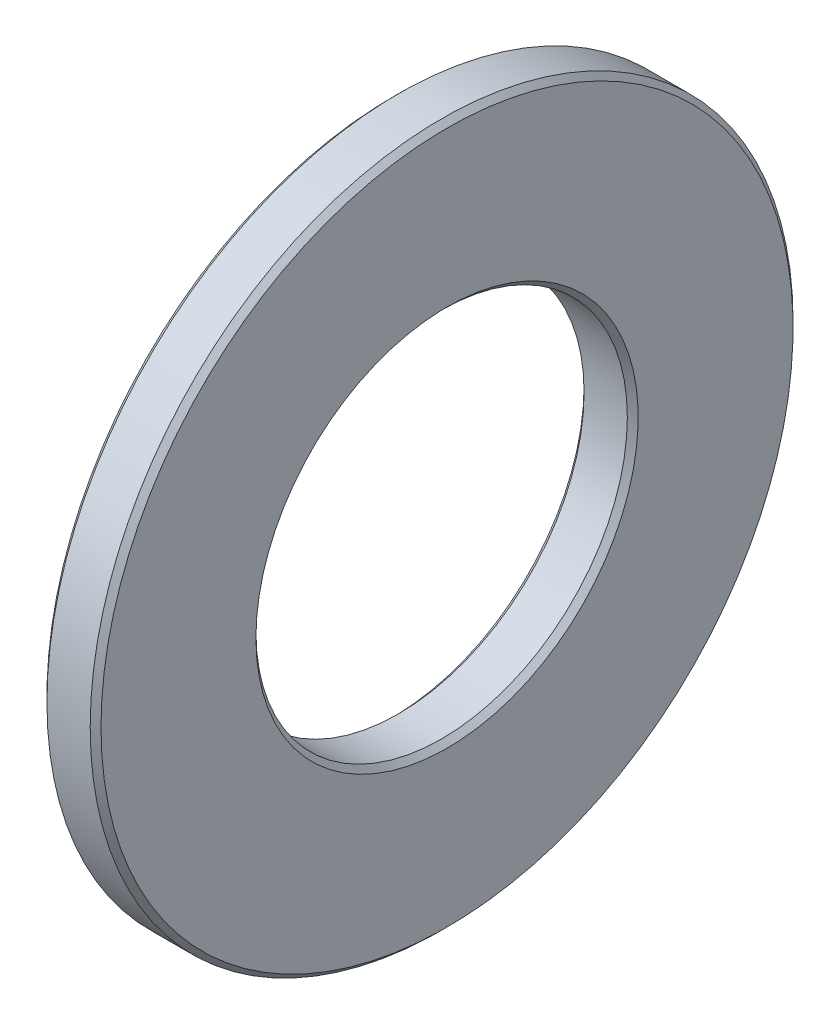
from build123d import *

# Parameters (mm, degrees)
SKETCH1_W     = 1.75
SKETCH1_H     = 3.065
CHAMFER1_SIZE = 0.1


# Read off the part's stored shape, not the designer's step: Move Face1
with BuildPart() as part:
    # Sketch1 → Base-Revolve (revolve)
    with BuildSketch(Plane.XY, mode=Mode.PRIVATE) as base_revolve_sk:
        with Locations((-0.875, 4.9675)):
            Rectangle(SKETCH1_W, SKETCH1_H)
    revolve(base_revolve_sk.sketch.rotate(Axis((-34.925, 0, 0), (1, 0, 0)), 90), axis=Axis((-34.925, 0, 0), (1, 0, 0)))

    # Chamfer1
    chamfer1_edges = [part.edges().sort_by_distance(p)[0] for p in [
        (-1.75, 0, -3.435),
        (-1.75, 0, -6.5),
        (0, 0, -6.5),
        (0, 0, -3.435),
    ]]
    chamfer(chamfer1_edges, length=CHAMFER1_SIZE)

    # Move Face1 outline → Move Face1 (revolve, cut)
    with BuildSketch(Plane.YX):
        Polygon((6.4, -1), (3.535, -1), (3.435, -0.9), (3.435, -1.65), (3.535, -1.75), (6.4, -1.75), (6.5, -1.65), (6.5, -0.9), align=None)
    revolve(axis=Axis((0, 0, 0), (1, 0, 0)), mode=Mode.SUBTRACT)


solid = part.part
